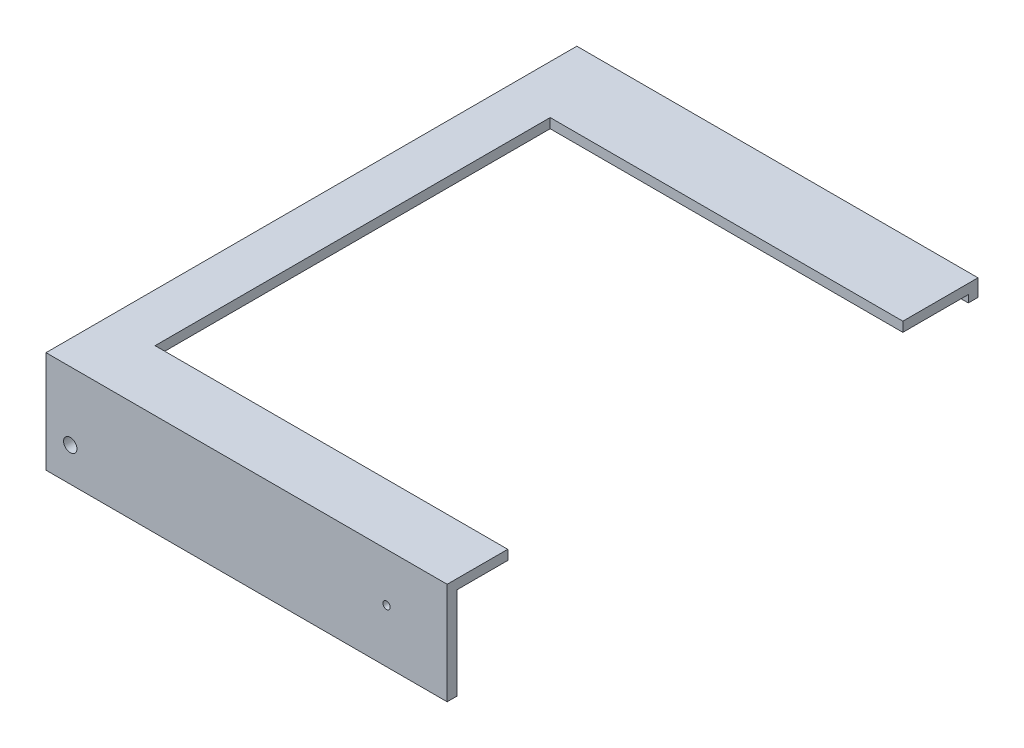
from build123d import *

# Parameters (mm, degrees)
SKETCH_1_W           = 165.5
SKETCH_1_H           = 38
EXTRUDE_1_DEPTH      = 4
SKETCH_2_W           = 20
SKETCH_2_H           = 215
EXTRUDE_2_DEPTH      = 4
SKETCH_3_W           = 211
SKETCH_3_H           = 10
EXTRUDE_3_DEPTH      = 4
SKETCH_4_W           = 145.5
SKETCH_4_H           = 25
EXTRUDE_4_DEPTH      = 4
SKETCH_5_R           = 1.5
CUT_EXTRUDE_1_DEPTH  = 4
SKETCH_6_W           = 165.5
SKETCH_6_H           = 7
EXTRUDE_5_DEPTH      = 4
SKETCH_7_W           = 145.5
SKETCH_7_H           = 27
EXTRUDE_6_DEPTH      = 4
SKETCH_8_R           = 2.75
CUT_EXTRUDE_2_DEPTH  = 4
MIRROR_START         = -4
MIRROR_3_OUTLINE_W   = 165.5
MIRROR_3_OUTLINE_H   = 42
MIRROR_3_OUTLINE_R   = 1.5
MIRROR_3_OUTLINE_R_2 = 2.75
MIRROR_3_DEPTH       = 4
MIRROR_START_2       = -215
MIRROR_3_2_DEPTH     = 211
MIRROR_START_3       = -25
MIRROR_3_3_OUTLINE_W = 145.5
MIRROR_3_3_OUTLINE_H = 4
MIRROR_3_3_DEPTH     = 21
MIRROR_START_4       = -219
MIRROR_3_4_OUTLINE_W = 165.5
MIRROR_3_4_OUTLINE_H = 7
MIRROR_3_4_DEPTH     = 4
SKETCH_9_W           = 186.740400525
SKETCH_9_H           = 237.71944978
CUT_EXTRUDE_3_DEPTH  = 278.696326947
SKETCH_10_W          = 145.5
SKETCH_10_H          = 27
EXTRUDE_7_DEPTH      = 4
SKETCH_11_R          = 1.5
CUT_EXTRUDE_4_DEPTH  = 20


# Read off the part's stored shape, not the designer's step: 镜向3
with BuildPart() as part:
    # 草图1 → 凸台-拉伸1 (new body)
    with BuildSketch(Plane.XY):
        with Locations((82.75, -19)):
            Rectangle(SKETCH_1_W, SKETCH_1_H)
    extrude(amount=EXTRUDE_1_DEPTH)

    # 草图2 → 凸台-拉伸2 (add)
    with BuildSketch(Plane(origin=(0, 0, 0), x_dir=(1, 0, 0), z_dir=(0, 1, 0))):
        with Locations((10, -107.5)):
            Rectangle(SKETCH_2_W, SKETCH_2_H)
    extrude(amount=EXTRUDE_2_DEPTH)

    # 草图3 → 凸台-拉伸3 (add)
    with BuildSketch(Plane.ZY):
        with Locations((109.5, -5)):
            Rectangle(SKETCH_3_W, SKETCH_3_H)
    extrude(amount=-EXTRUDE_3_DEPTH)

    # 草图4 → 凸台-拉伸4 (add)
    with BuildSketch(Plane(origin=(0, 0, 0), x_dir=(1, 0, 0), z_dir=(0, 1, 0))):
        with Locations((92.75, -12.5)):
            Rectangle(SKETCH_4_W, SKETCH_4_H)
    extrude(amount=EXTRUDE_4_DEPTH)

    # 草图5 → 切除-拉伸1 (cut)
    with BuildSketch(Plane(origin=(0, 0, 0), x_dir=(-1, 0, 0), z_dir=(0, 0, -1))):
        with Locations((-140.5, -16)):
            Circle(SKETCH_5_R)
    extrude(amount=-CUT_EXTRUDE_1_DEPTH, mode=Mode.SUBTRACT)

    # 草图6 → 凸台-拉伸5 (add)
    with BuildSketch(Plane.XY.offset(215)):
        with Locations((82.75, 0.5)):
            Rectangle(SKETCH_6_W, SKETCH_6_H)
    extrude(amount=EXTRUDE_5_DEPTH)

    # 草图8 → 切除-拉伸2 (cut)
    with BuildSketch(Plane(origin=(0, 0, 0), x_dir=(-1, 0, 0), z_dir=(0, 0, -1))):
        with Locations((-10, -24)):
            Circle(SKETCH_8_R)
    extrude(amount=-CUT_EXTRUDE_2_DEPTH, mode=Mode.SUBTRACT)

    # 镜向3 outline → 镜向3 (add)
    with BuildSketch(Plane.XY.offset(MIRROR_START)):
        with Locations((82.75, -17)):
            Rectangle(MIRROR_3_OUTLINE_W, MIRROR_3_OUTLINE_H)
        with Locations((140.5, -16)):
            Circle(MIRROR_3_OUTLINE_R, mode=Mode.SUBTRACT)
        with Locations((10, -24)):
            Circle(MIRROR_3_OUTLINE_R_2, mode=Mode.SUBTRACT)
    extrude(amount=MIRROR_3_DEPTH)

    # Mirror 3 2 outline → Mirror 3 2 (add)
    with BuildSketch(Plane.XY.offset(MIRROR_START_2)):
        Polygon((20, 0), (20, 4), (0, 4), (0, -10), (4, -10), (4, 0), align=None)
    extrude(amount=MIRROR_3_2_DEPTH)

    # Mirror 3 3 outline → Mirror 3 3 (add)
    with BuildSketch(Plane.XY.offset(MIRROR_START_3)):
        with Locations((92.75, 2)):
            Rectangle(MIRROR_3_3_OUTLINE_W, MIRROR_3_3_OUTLINE_H)
    extrude(amount=MIRROR_3_3_DEPTH)

    # Mirror 3 4 outline → Mirror 3 4 (add)
    with BuildSketch(Plane.XY.offset(MIRROR_START_4)):
        with Locations((82.75, 0.5)):
            Rectangle(MIRROR_3_4_OUTLINE_W, MIRROR_3_4_OUTLINE_H)
    extrude(amount=MIRROR_3_4_DEPTH)


with BuildPart() as body_2:
    # 草图7 → 凸台-拉伸6 (new body)
    with BuildSketch(Plane(origin=(0, 4, 0), x_dir=(1, 0, 0), z_dir=(0, 1, 0))):
        with Locations((92.75, -201.5)):
            Rectangle(SKETCH_7_W, SKETCH_7_H)
    extrude(amount=-EXTRUDE_6_DEPTH)


with BuildPart() as cut_extrude_3_tool:
    # 草图9 → 切除-拉伸3 (new, through all)
    with BuildSketch(Plane(origin=(0, 4, 0), x_dir=(1, 0, 0), z_dir=(0, 1, 0))):
        with Locations((93.370200263, -118.85972489)):
            Rectangle(SKETCH_9_W, SKETCH_9_H)
    extrude(amount=-CUT_EXTRUDE_3_DEPTH)


with BuildPart() as part_1:
    add(part.part)

    # 切除-拉伸3: cut by cut_extrude_3_tool
    add(cut_extrude_3_tool.part, mode=Mode.SUBTRACT)

    # 草图10 → 凸台-拉伸7 (add)
    with BuildSketch(Plane(origin=(0, 4, 0), x_dir=(1, 0, 0), z_dir=(0, 1, 0))):
        with Locations((92.75, 201.5)):
            Rectangle(SKETCH_10_W, SKETCH_10_H)
    extrude(amount=-EXTRUDE_7_DEPTH)

    # 草图11 → 切除-拉伸4 (cut)
    with BuildSketch(Plane(origin=(0, 0, -219), x_dir=(-1, 0, 0), z_dir=(0, 0, -1))):
        with Locations((-155.5, 1)):
            Circle(SKETCH_11_R)
    extrude(amount=-CUT_EXTRUDE_4_DEPTH, mode=Mode.SUBTRACT)


with BuildPart() as body_2_1:
    add(body_2.part)

    # 切除-拉伸3: cut by cut_extrude_3_tool
    add(cut_extrude_3_tool.part, mode=Mode.SUBTRACT)


solid = part_1.part
